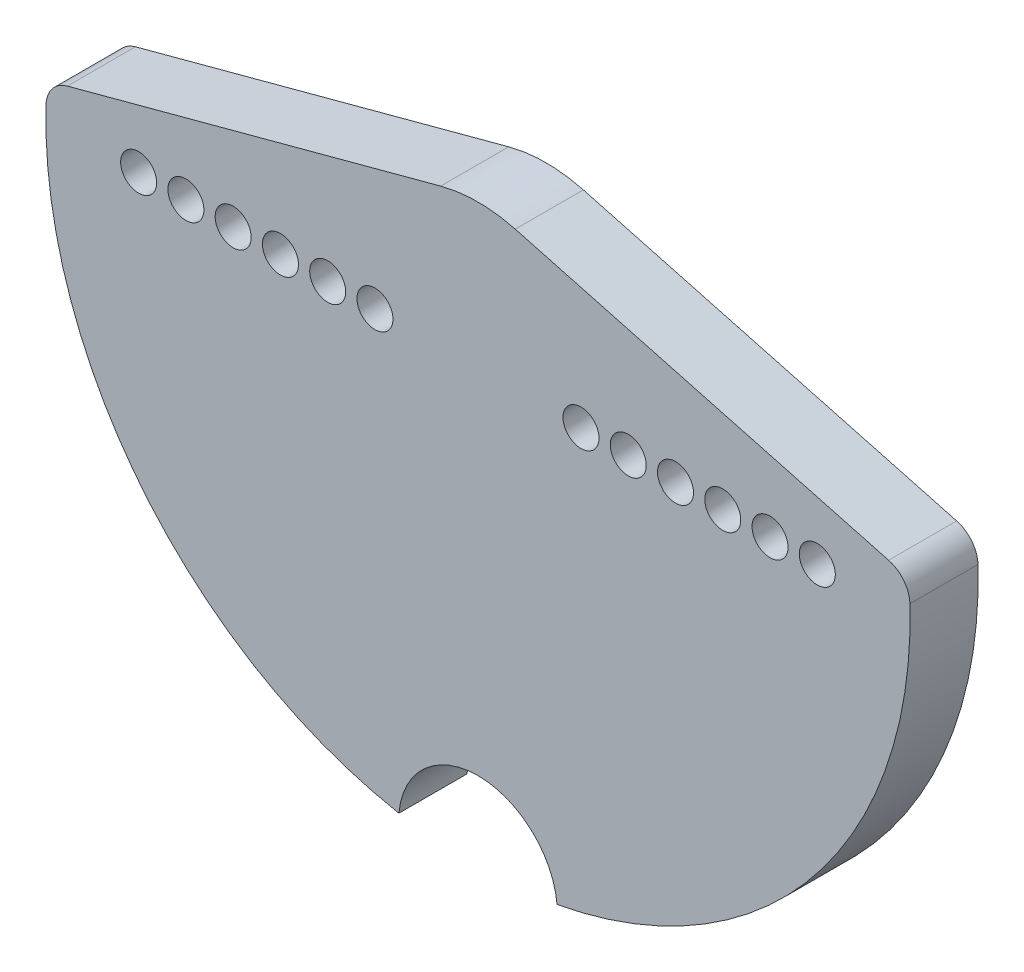
from build123d import *

# Parameters (mm, degrees)
BOSS_EXTRUDE1_DEPTH = 3
SKETCH2_R           = 0.79375
CUT_EXTRUDE1_DEPTH  = 27.882306013


with BuildPart() as part:
    # Sketch1 → Boss-Extrude1 (new body)
    with BuildSketch(Plane.XY):
        with BuildLine():
            Line((1.643500936, 6.133628997), (18.101754599, 1.723653219))
            ThreePointArc((18.101754599, 1.723653219), (18.769709759, 1.284060268), (19.042558299, 0.532422235))
            ThreePointArc((19.042558299, 0.532422235), (14.819600097, -11.970043984), (3.485200626, -18.72847769))
            ThreePointArc((3.485200626, -18.72847769), (0, -15.55), (-3.485200626, -18.72847769))
            ThreePointArc((-3.485200626, -18.72847769), (-14.819600097, -11.970043984), (-19.042558299, 0.532422235))
            ThreePointArc((-19.042558299, 0.532422235), (-18.769709759, 1.284060268), (-18.101754599, 1.723653219))
            Line((-18.101754599, 1.723653219), (-1.643500936, 6.133628997))
            ThreePointArc((-1.643500936, 6.133628997), (0, 6.35), (1.643500936, 6.133628997))
        make_face()
    extrude(amount=BOSS_EXTRUDE1_DEPTH)

    # Sketch2 → Cut-Extrude1 (cut, symmetric)
    with BuildSketch(Plane.XY.offset(3)):
        with Locations((-12.875, 0)):
            Circle(SKETCH2_R)
        with Locations((-14.958333333, 0)):
            Circle(SKETCH2_R)
        with Locations((-4.541666667, 0)):
            Circle(SKETCH2_R)
        with Locations((-6.625, 0)):
            Circle(SKETCH2_R)
        with Locations((-8.708333333, 0)):
            Circle(SKETCH2_R)
        with Locations((-10.791666667, 0)):
            Circle(SKETCH2_R)
    cut_extrude1 = extrude(amount=CUT_EXTRUDE1_DEPTH, both=True, mode=Mode.SUBTRACT)

    # Mirror1: Cut-Extrude1 across plane
    add(cut_extrude1.mirror(Plane(origin=(0, 0, 0), x_dir=(0, 0, 1), z_dir=(1, 0, 0))), mode=Mode.SUBTRACT)


solid = part.part
